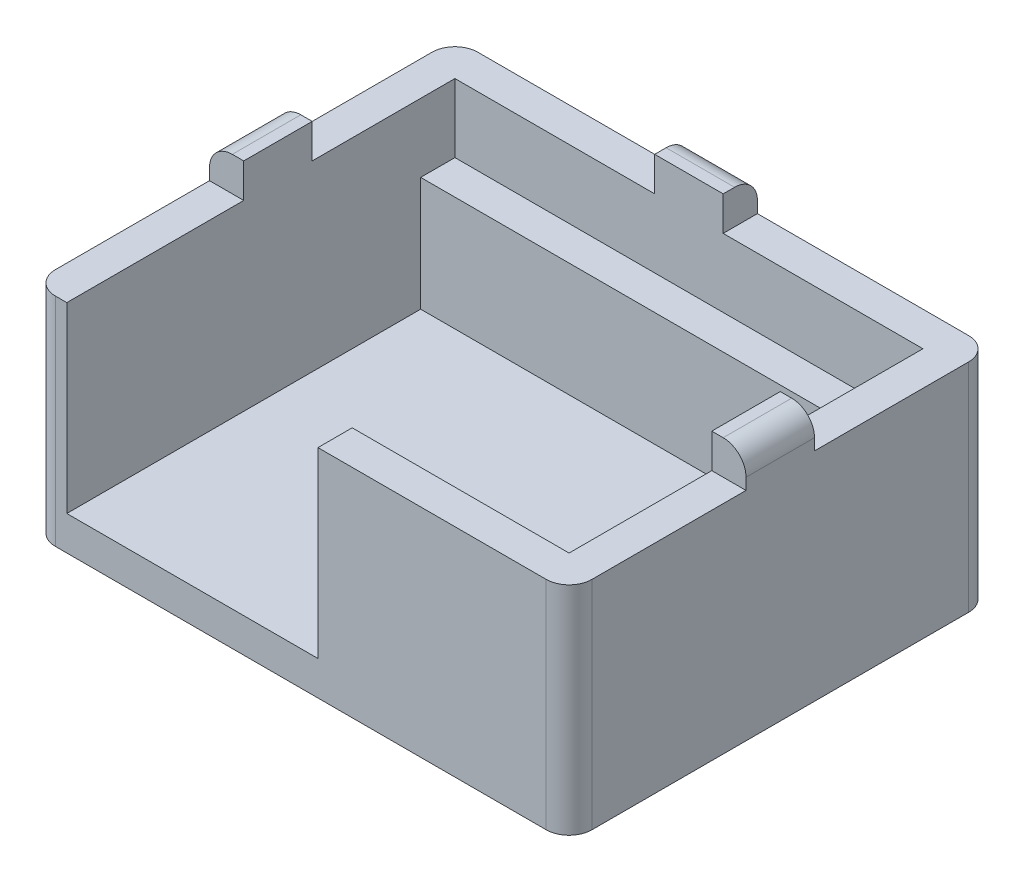
from build123d import *

# Parameters (mm, degrees)
SKETCH1_W                 = 20.5
SKETCH1_H                 = 15.5
BOSS_EXTRUDE1_DEPTH       = 8
SHELL1_T                  = 1.5
BOSS_EXTRUDE2_START       = 8
BOSS_EXTRUDE2_OUTLINE_W   = 1.5
BOSS_EXTRUDE2_OUTLINE_H   = 3
BOSS_EXTRUDE2_OUTLINE_W_2 = 3
BOSS_EXTRUDE2_OUTLINE_H_2 = 1.5
BOSS_EXTRUDE2_DEPTH       = 1.5
SKETCH3_W                 = 10
SKETCH3_H                 = 1.5
CUT_EXTRUDE1_DEPTH        = 8
SKETCH4_W                 = 20.5
SKETCH4_H                 = 1.5
BOSS_EXTRUDE3_DEPTH       = 5
FILLET1_R                 = 1
FILLET2_R                 = 1
FILLET3_R                 = 1
SKETCH5_W                 = 1
SKETCH5_H                 = 1.5
CUT_EXTRUDE3_DEPTH        = 8


# Read off the part's stored shape, not the designer's step: Boss-Extrude2
with BuildPart() as part:
    # Sketch1 → Boss-Extrude1 (new body)
    with BuildSketch(Plane(origin=(0, 0, 0), x_dir=(1, 0, 0), z_dir=(0, 1, 0))):
        with Locations((-3.611209964, -0.053380783)):
            Rectangle(SKETCH1_W, SKETCH1_H)
    extrude(amount=BOSS_EXTRUDE1_DEPTH)

    # Shell1
    shell1_openings = [part.faces().sort_by_distance(p)[0] for p in [
        (-3.611209964, 8, 0.053380783),
    ]]
    offset(amount=SHELL1_T, openings=shell1_openings, kind=Kind.INTERSECTION)

    # Boss-Extrude2 outline → Boss-Extrude2 (add)
    with BuildSketch(Plane(origin=(0, 0, 0), x_dir=(1, 0, 0), z_dir=(0, 1, 0)).offset(BOSS_EXTRUDE2_START)):
        with Locations((-14.611209964, -0.053380783)):
            Rectangle(BOSS_EXTRUDE2_OUTLINE_W, BOSS_EXTRUDE2_OUTLINE_H)
        with Locations((-3.611209964, 8.446619217)):
            Rectangle(BOSS_EXTRUDE2_OUTLINE_W_2, BOSS_EXTRUDE2_OUTLINE_H_2)
        with Locations((7.388790036, -0.053380783)):
            Rectangle(BOSS_EXTRUDE2_OUTLINE_W, BOSS_EXTRUDE2_OUTLINE_H)
    extrude(amount=BOSS_EXTRUDE2_DEPTH)

    # Sketch3 → Cut-Extrude1 (cut)
    with BuildSketch(Plane(origin=(0, 8, 0), x_dir=(1, 0, 0), z_dir=(0, 1, 0))):
        with Locations((-8.861209964, -8.553380783)):
            Rectangle(SKETCH3_W, SKETCH3_H)
    extrude(amount=-CUT_EXTRUDE1_DEPTH, mode=Mode.SUBTRACT)

    # Sketch4 → Boss-Extrude3 (add)
    with BuildSketch(Plane(origin=(0, 0, 0), x_dir=(1, 0, 0), z_dir=(0, 1, 0))):
        with Locations((-3.611209964, 6.946619217)):
            Rectangle(SKETCH4_W, SKETCH4_H)
    extrude(amount=BOSS_EXTRUDE3_DEPTH)

    # Fillet1
    fillet1_edges = [part.edges().sort_by_distance(p)[0] for p in [
        (-15.361209964, 9.5, 0.053380783),
    ]]
    fillet(fillet1_edges, radius=FILLET1_R)

    # Fillet2
    fillet2_edges = [part.edges().sort_by_distance(p)[0] for p in [
        (-3.611209964, 9.5, -9.196619217),
        (8.138790036, 9.5, 0.053380783),
    ]]
    fillet(fillet2_edges, radius=FILLET2_R)

    # Fillet3
    fillet3_edges = [part.edges().sort_by_distance(p)[0] for p in [
        (-15.361209964, 3.25, -9.196619217),
        (8.138790036, 3.25, -9.196619217),
        (8.138790036, 3.25, 9.303380783),
        (-15.361209964, 3.25, 9.303380783),
    ]]
    fillet(fillet3_edges, radius=FILLET3_R)

    # Sketch5 → Cut-Extrude3 (cut)
    with BuildSketch(Plane(origin=(0, 8, 0), x_dir=(1, 0, 0), z_dir=(0, 1, 0))):
        with Locations((-3.361209964, -8.553380783)):
            Rectangle(SKETCH5_W, SKETCH5_H)
    extrude(amount=-CUT_EXTRUDE3_DEPTH, mode=Mode.SUBTRACT)


solid = part.part
